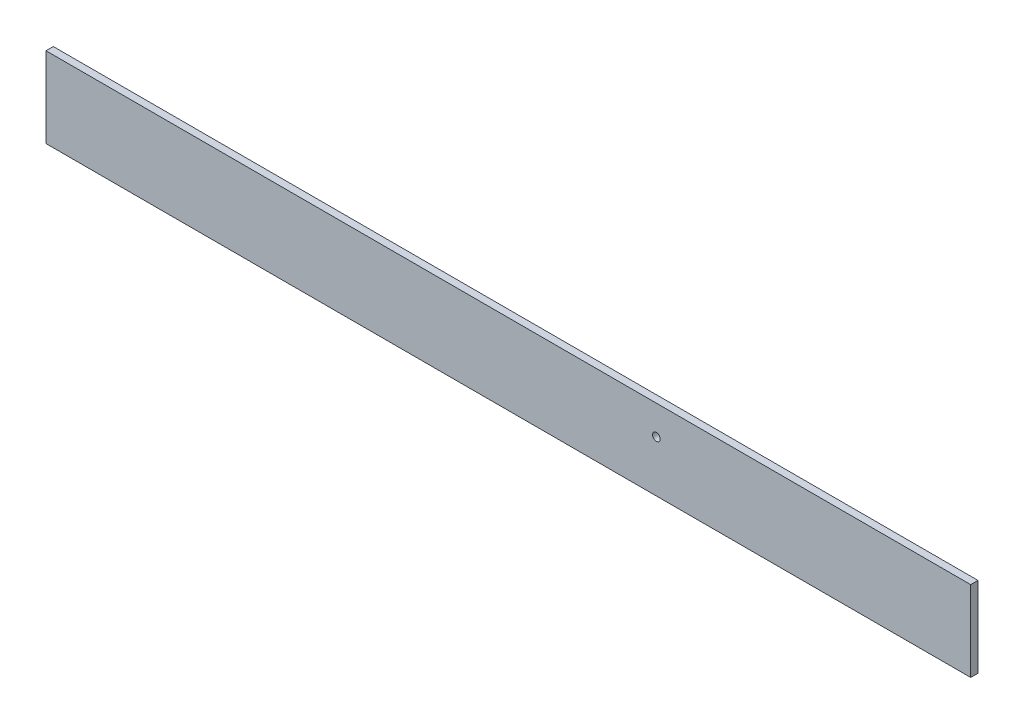
from build123d import *

# Parameters (mm, degrees)
SKETCH2_W           = 506
SKETCH2_H           = 44
SKETCH2_R           = 2.1
BOSS_EXTRUDE1_DEPTH = 4


with BuildPart() as part:
    # Sketch2 → Boss-Extrude1 (new body)
    with BuildSketch(Plane.XY):
        Rectangle(SKETCH2_W, SKETCH2_H)
        with Locations((81, 6)):
            Circle(SKETCH2_R, mode=Mode.SUBTRACT)
    extrude(amount=BOSS_EXTRUDE1_DEPTH)


solid = part.part
